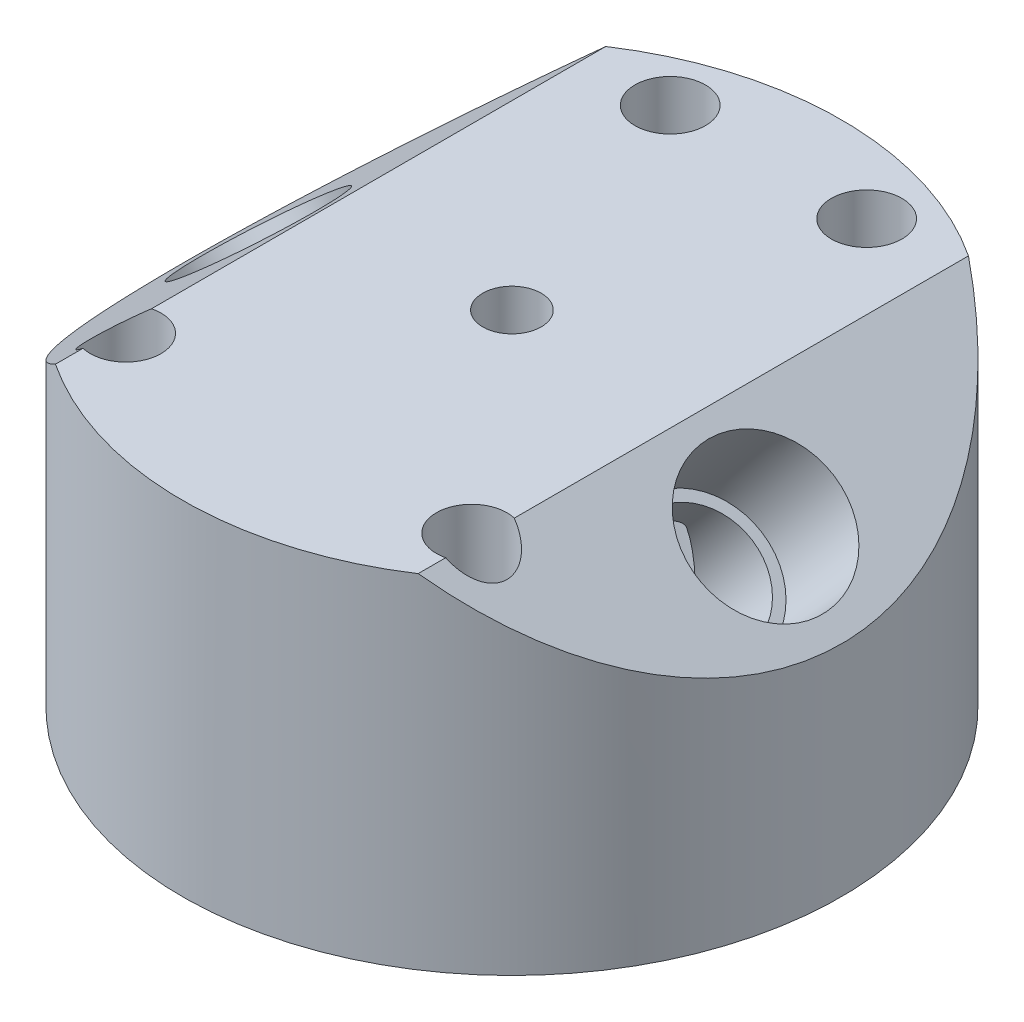
from build123d import *

# Parameters (mm, degrees)
CUT_EXTRUDE1_DEPTH         = 58.529738397
CUT_EXTRUDE1_DEPTH_BACK    = 58.529738397
F_1_4_28_TAPPED_HOLE1_D    = 5.4102
CUT_EXTRUDE2_START         = -6.35
SKETCH5_R                  = 30.48
CUT_EXTRUDE2_DEPTH         = 6.35
USE_ROUND_CORNER_ENDMILL_R = 0.762
F_1_4_CLEARANCE_HOLE2_D    = 6.5278


with BuildPart() as part:
    # MASTER → MASTER_SKETCH (revolve)
    with BuildSketch(Plane.XY):
        Polygon((0, 38.1), (-30.48, 38.1), (-30.48, 0), (-12.7, 0), (-12.7, 19.05), (-6.3246, 19.05), (-4.7625, 17.4879), (0, 17.4879), align=None)
    revolve(axis=Axis((0, 38.1, 0), (0, -1, 0)))

    # Sketch2 → Cut-Extrude1 (cut, two sides: drawn at the far end of the back side and taken through both)
    with BuildSketch(Plane.XY.offset(-CUT_EXTRUDE1_DEPTH_BACK)):
        Polygon((-30.48, 20.248277745), (-9.205145869, 38.1), (-30.48, 38.1), align=None)
        Polygon((30.48, 38.1), (9.205145869, 38.1), (30.48, 20.248277745), align=None)
    extrude(amount=CUT_EXTRUDE1_DEPTH + CUT_EXTRUDE1_DEPTH_BACK, mode=Mode.SUBTRACT)

    # 1/4-28 Tapped Hole1 (through all)
    with Locations(Plane(origin=(0, 38.1, 0), x_dir=(1, 0, 0), z_dir=(0, 1, 0))):
        with Locations((0, 0)):
            Hole(F_1_4_28_TAPPED_HOLE1_D / 2)

    # Sketch5 → Cut-Extrude2 (cut)
    with BuildSketch(Plane(origin=(0, 38.1, 0), x_dir=(1, 0, 0), z_dir=(0, 1, 0)).offset(CUT_EXTRUDE2_START)):
        Circle(SKETCH5_R)
    extrude(amount=CUT_EXTRUDE2_DEPTH, mode=Mode.SUBTRACT)

    # use-round-corner-endmill
    use_round_corner_endmill_edges = [part.edges().sort_by_distance(p)[0] for p in [
        (6.3246, 19.05, 0),
        (12.7, 19.05, 0),
    ]]
    fillet(use_round_corner_endmill_edges, radius=USE_ROUND_CORNER_ENDMILL_R)

    # Sketch7 → 1/4 NPT Tapped Hole1 (revolve, cut)
    with BuildSketch(Plane(origin=(-23.455832083, 26.142254454, 0), x_dir=(-0.7660444431189741, -0.642787609686544, 0), z_dir=(0, 0, 1))):
        Polygon((0, 0), (0, 54.695413336), (5.5626, 54.695413336), (5.5626, 9.906), (6.557984794, 9.906), (6.8545837, 0), align=None)
    f_1_4_npt_tapped_hole1 = revolve(axis=Axis((-27.537533405, 31.006636667, 0), (0.6427876096865441, -0.7660444431189741, 0)), mode=Mode.SUBTRACT)

    # Mirror1: 1/4 NPT Tapped Hole1 across plane
    add(f_1_4_npt_tapped_hole1.mirror(Plane(origin=(0, 0, 0), x_dir=(0, 0, 1), z_dir=(1, 0, 0))), mode=Mode.SUBTRACT)

    # 1/4 Clearance Hole2 (through all)
    with Locations(Plane(origin=(0, 31.75, 0), x_dir=(1, 0, 0), z_dir=(0, 1, 0))):
        with Locations((16, -19.727138667), (-16, -19.727138667), (9.08420323, 23.719975794), (-9.08420323, 23.719975794)):
            Hole(F_1_4_CLEARANCE_HOLE2_D / 2)


solid = part.part
